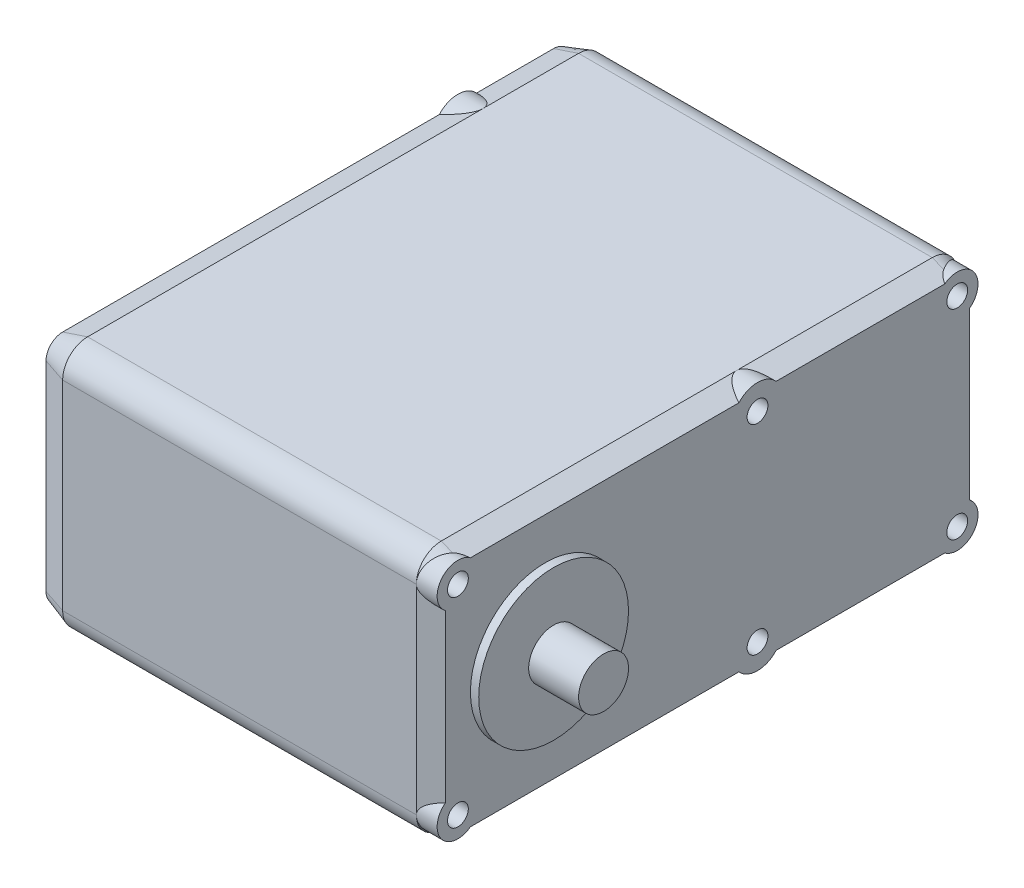
from build123d import *
from OCP.BRepFilletAPI import BRepFilletAPI_MakeChamfer

# Parameters (mm, degrees)
SKETCH1_W           = 48
SKETCH1_H           = 65
BOSS_EXTRUDE1_DEPTH = 30
FILLET2_R           = 3
SKETCH2_R           = 9
BOSS_EXTRUDE2_DEPTH = 1
BOSS_EXTRUDE4_START = 1
SKETCH4_R           = 9
BOSS_EXTRUDE4_DEPTH = 1
SKETCH5_R           = 3
BOSS_EXTRUDE5_DEPTH = 6
CHAMFER1_SIZE       = 3
CHAMFER1_SIZE2      = 1.000002977
CHAMFER2_SIZE       = 1
CHAMFER3_SIZE       = 2.5
CHAMFER3_SIZE2      = 0.99992866
SKETCH6_R           = 3
SKETCH6_R_2         = 2.5
BOSS_EXTRUDE6_DEPTH = 2.5
SKETCH7_R           = 2.500002977
SKETCH7_R_2         = 3
BOSS_EXTRUDE7_DEPTH = 3
SKETCH8_R           = 1.25
CUT_EXTRUDE1_DEPTH  = 5
SKETCH10_R          = 1.25
CUT_EXTRUDE2_DEPTH  = 5


with BuildPart() as part:
    # Sketch1 → Boss-Extrude1 (new body)
    with BuildSketch(Plane(origin=(0, 0, 0), x_dir=(1, 0, 0), z_dir=(0, 1, 0))):
        Rectangle(SKETCH1_W, SKETCH1_H)
    extrude(amount=BOSS_EXTRUDE1_DEPTH)

    # Fillet2
    fillet2_edges = [part.edges().sort_by_distance(p)[0] for p in [
        (0, 30, -32.5),
        (0, 0, -32.5),
        (0, 0, 32.5),
        (0, 30, 32.5),
    ]]
    fillet(fillet2_edges, radius=FILLET2_R)

    # Sketch2 → Boss-Extrude2 (add)
    with BuildSketch(Plane.ZY.offset(24)):
        with Locations(Location((19.5, 15, 0), (0, 0, 180))):
            Circle(SKETCH2_R)
    extrude(amount=BOSS_EXTRUDE2_DEPTH)

    # Sketch4 → Boss-Extrude4 (add)
    with BuildSketch(Plane(origin=(24, 0, 0), x_dir=(0, 0, -1), z_dir=(1, 0, 0)).offset(BOSS_EXTRUDE4_START)):
        with Locations((-19.5, 15)):
            Circle(SKETCH4_R)
    extrude(amount=-BOSS_EXTRUDE4_DEPTH)

    # Sketch5 → Boss-Extrude5 (add)
    with BuildSketch(Plane(origin=(25, 0, 0), x_dir=(0, 0, -1), z_dir=(1, 0, 0))):
        with Locations((-19.5, 15)):
            Circle(SKETCH5_R)
    extrude(amount=BOSS_EXTRUDE5_DEPTH)

    # Chamfer1: one chamfer whose edges measure the first distance from different faces: ONE call of the kernel's chamfer builder (chamfer() names one face for all edges)
    chamfer1_edges_1 = [part.edges().sort_by_distance(p)[0] for p in [
        (-24, 30, 0),
    ]]
    chamfer1_side_1 = [part.faces().sort_by_distance(p)[0] for p in [
        (0, 30, 0),
    ]]
    chamfer1_edges_2 = [part.edges().sort_by_distance(p)[0] for p in [
        (-24, 0, 0),
    ]]
    chamfer1_side_2 = [part.faces().sort_by_distance(p)[0] for p in [
        (0, 0, 0),
    ]]
    chamfer1_edges_3 = [part.edges().sort_by_distance(p)[0] for p in [
        (-24, 15, 32.5),
    ]]
    chamfer1_side_3 = [part.faces().sort_by_distance(p)[0] for p in [
        (0, 15, 32.5),
    ]]
    chamfer1_edges_4 = [part.edges().sort_by_distance(p)[0] for p in [
        (-24, 15, -32.5),
    ]]
    chamfer1_side_4 = [part.faces().sort_by_distance(p)[0] for p in [
        (0, 15, -32.5),
    ]]
    chamfer1_edges_5 = [part.edges().sort_by_distance(p)[0] for p in [
        (-24, 29.121320344, 31.621320344),
    ]]
    chamfer1_side_5 = [part.faces().sort_by_distance(p)[0] for p in [
        (0, 29.121320344, 31.621320344),
    ]]
    chamfer1_edges_6 = [part.edges().sort_by_distance(p)[0] for p in [
        (-24, 0.878679656, 31.621320344),
    ]]
    chamfer1_side_6 = [part.faces().sort_by_distance(p)[0] for p in [
        (0, 0.878679656, 31.621320344),
    ]]
    chamfer1_edges_7 = [part.edges().sort_by_distance(p)[0] for p in [
        (-24, 0.878679656, -31.621320344),
    ]]
    chamfer1_side_7 = [part.faces().sort_by_distance(p)[0] for p in [
        (0, 0.878679656, -31.621320344),
    ]]
    chamfer1_edges_8 = [part.edges().sort_by_distance(p)[0] for p in [
        (-24, 29.121320344, -31.621320344),
    ]]
    chamfer1_side_8 = [part.faces().sort_by_distance(p)[0] for p in [
        (0, 29.121320344, -31.621320344),
    ]]
    chamfer1 = BRepFilletAPI_MakeChamfer(part.part.solid().wrapped)
    for e in chamfer1_edges_1:
        chamfer1.Add(CHAMFER1_SIZE, CHAMFER1_SIZE2, e.wrapped, chamfer1_side_1[0].wrapped)  # the first distance lies on this face
    for e in chamfer1_edges_2:
        chamfer1.Add(CHAMFER1_SIZE, CHAMFER1_SIZE2, e.wrapped, chamfer1_side_2[0].wrapped)  # the first distance lies on this face
    for e in chamfer1_edges_3:
        chamfer1.Add(CHAMFER1_SIZE, CHAMFER1_SIZE2, e.wrapped, chamfer1_side_3[0].wrapped)  # the first distance lies on this face
    for e in chamfer1_edges_4:
        chamfer1.Add(CHAMFER1_SIZE, CHAMFER1_SIZE2, e.wrapped, chamfer1_side_4[0].wrapped)  # the first distance lies on this face
    for e in chamfer1_edges_5:
        chamfer1.Add(CHAMFER1_SIZE, CHAMFER1_SIZE2, e.wrapped, chamfer1_side_5[0].wrapped)  # the first distance lies on this face
    for e in chamfer1_edges_6:
        chamfer1.Add(CHAMFER1_SIZE, CHAMFER1_SIZE2, e.wrapped, chamfer1_side_6[0].wrapped)  # the first distance lies on this face
    for e in chamfer1_edges_7:
        chamfer1.Add(CHAMFER1_SIZE, CHAMFER1_SIZE2, e.wrapped, chamfer1_side_7[0].wrapped)  # the first distance lies on this face
    for e in chamfer1_edges_8:
        chamfer1.Add(CHAMFER1_SIZE, CHAMFER1_SIZE2, e.wrapped, chamfer1_side_8[0].wrapped)  # the first distance lies on this face
    add(Compound.cast(chamfer1.Shape()), mode=Mode.REPLACE)

    # Chamfer2
    chamfer2_edges = [part.edges().sort_by_distance(p)[0] for p in [
        (-25, 15, 28.5),
    ]]
    chamfer(chamfer2_edges, length=CHAMFER2_SIZE - 0.0001)  # a hair under: the kernel refuses the full size

    # Chamfer3: one chamfer whose edges measure the first distance from different faces: ONE call of the kernel's chamfer builder (chamfer() names one face for all edges)
    chamfer3_edges_1 = [part.edges().sort_by_distance(p)[0] for p in [
        (24, 30, 0),
    ]]
    chamfer3_side_1 = [part.faces().sort_by_distance(p)[0] for p in [
        (1.5, 30, 0),
    ]]
    chamfer3_edges_2 = [part.edges().sort_by_distance(p)[0] for p in [
        (24, 15, -32.5),
    ]]
    chamfer3_side_2 = [part.faces().sort_by_distance(p)[0] for p in [
        (1.5, 15, -32.5),
    ]]
    chamfer3_edges_3 = [part.edges().sort_by_distance(p)[0] for p in [
        (24, 0, 0),
    ]]
    chamfer3_side_3 = [part.faces().sort_by_distance(p)[0] for p in [
        (1.5, 0, 0),
    ]]
    chamfer3_edges_4 = [part.edges().sort_by_distance(p)[0] for p in [
        (24, 15, 32.5),
    ]]
    chamfer3_side_4 = [part.faces().sort_by_distance(p)[0] for p in [
        (1.5, 15, 32.5),
    ]]
    chamfer3_edges_5 = [part.edges().sort_by_distance(p)[0] for p in [
        (24, 29.121320344, 31.621320344),
    ]]
    chamfer3_side_5 = [part.faces().sort_by_distance(p)[0] for p in [
        (1.5, 29.121320344, 31.621320344),
    ]]
    chamfer3_edges_6 = [part.edges().sort_by_distance(p)[0] for p in [
        (24, 0.878679656, 31.621320344),
    ]]
    chamfer3_side_6 = [part.faces().sort_by_distance(p)[0] for p in [
        (1.5, 0.878679656, 31.621320344),
    ]]
    chamfer3_edges_7 = [part.edges().sort_by_distance(p)[0] for p in [
        (24, 0.878679656, -31.621320344),
    ]]
    chamfer3_side_7 = [part.faces().sort_by_distance(p)[0] for p in [
        (1.5, 0.878679656, -31.621320344),
    ]]
    chamfer3_edges_8 = [part.edges().sort_by_distance(p)[0] for p in [
        (24, 29.121320344, -31.621320344),
    ]]
    chamfer3_side_8 = [part.faces().sort_by_distance(p)[0] for p in [
        (1.5, 29.121320344, -31.621320344),
    ]]
    chamfer3 = BRepFilletAPI_MakeChamfer(part.part.solid().wrapped)
    for e in chamfer3_edges_1:
        chamfer3.Add(CHAMFER3_SIZE, CHAMFER3_SIZE2, e.wrapped, chamfer3_side_1[0].wrapped)  # the first distance lies on this face
    for e in chamfer3_edges_2:
        chamfer3.Add(CHAMFER3_SIZE, CHAMFER3_SIZE2, e.wrapped, chamfer3_side_2[0].wrapped)  # the first distance lies on this face
    for e in chamfer3_edges_3:
        chamfer3.Add(CHAMFER3_SIZE, CHAMFER3_SIZE2, e.wrapped, chamfer3_side_3[0].wrapped)  # the first distance lies on this face
    for e in chamfer3_edges_4:
        chamfer3.Add(CHAMFER3_SIZE, CHAMFER3_SIZE2, e.wrapped, chamfer3_side_4[0].wrapped)  # the first distance lies on this face
    for e in chamfer3_edges_5:
        chamfer3.Add(CHAMFER3_SIZE, CHAMFER3_SIZE2, e.wrapped, chamfer3_side_5[0].wrapped)  # the first distance lies on this face
    for e in chamfer3_edges_6:
        chamfer3.Add(CHAMFER3_SIZE, CHAMFER3_SIZE2, e.wrapped, chamfer3_side_6[0].wrapped)  # the first distance lies on this face
    for e in chamfer3_edges_7:
        chamfer3.Add(CHAMFER3_SIZE, CHAMFER3_SIZE2, e.wrapped, chamfer3_side_7[0].wrapped)  # the first distance lies on this face
    for e in chamfer3_edges_8:
        chamfer3.Add(CHAMFER3_SIZE, CHAMFER3_SIZE2, e.wrapped, chamfer3_side_8[0].wrapped)  # the first distance lies on this face
    add(Compound.cast(chamfer3.Shape()), mode=Mode.REPLACE)

    # Sketch6 → Boss-Extrude6 (add)
    with BuildSketch(Plane(origin=(24, 0, 0), x_dir=(0, 0, -1), z_dir=(1, 0, 0))):
        with Locations((6, 27)):
            Circle(SKETCH6_R)
        with Locations((6, 3)):
            Circle(SKETCH6_R)
        with Locations((-30, 3)):
            Circle(SKETCH6_R_2)
        with Locations((-30, 27)):
            Circle(SKETCH6_R_2)
        with Locations((30, 27)):
            Circle(SKETCH6_R_2)
        with Locations((30, 3)):
            Circle(SKETCH6_R_2)
    extrude(amount=-BOSS_EXTRUDE6_DEPTH)

    # Sketch7 → Boss-Extrude7 (add)
    with BuildSketch(Plane.ZY.offset(24)):
        with Locations((-29.999997023, 15)):
            Circle(SKETCH7_R)
        with Locations((-17.999997023, 3)):
            Circle(SKETCH7_R_2)
        with Locations((-17.999997023, 27)):
            Circle(SKETCH7_R_2)
    extrude(amount=-BOSS_EXTRUDE7_DEPTH)

    # Sketch8 → Cut-Extrude1 (cut)
    with BuildSketch(Plane.ZY.offset(24)):
        with Locations((-17.999997023, 27)):
            Circle(SKETCH8_R)
        with Locations((-29.999997023, 15)):
            Circle(SKETCH8_R)
        with Locations((-17.999997023, 3)):
            Circle(SKETCH8_R)
    extrude(amount=-CUT_EXTRUDE1_DEPTH, mode=Mode.SUBTRACT)

    # Sketch10 → Cut-Extrude2 (cut)
    with BuildSketch(Plane(origin=(24, 0, 0), x_dir=(0, 0, -1), z_dir=(1, 0, 0))):
        with Locations((6, 3)):
            Circle(SKETCH10_R)
        with Locations((30, 3)):
            Circle(SKETCH10_R)
        with Locations((6, 27)):
            Circle(SKETCH10_R)
        with Locations((30, 27)):
            Circle(SKETCH10_R)
        with Locations((-30, 3)):
            Circle(SKETCH10_R)
        with Locations((-30, 27)):
            Circle(SKETCH10_R)
    extrude(amount=-CUT_EXTRUDE2_DEPTH, mode=Mode.SUBTRACT)


solid = part.part
